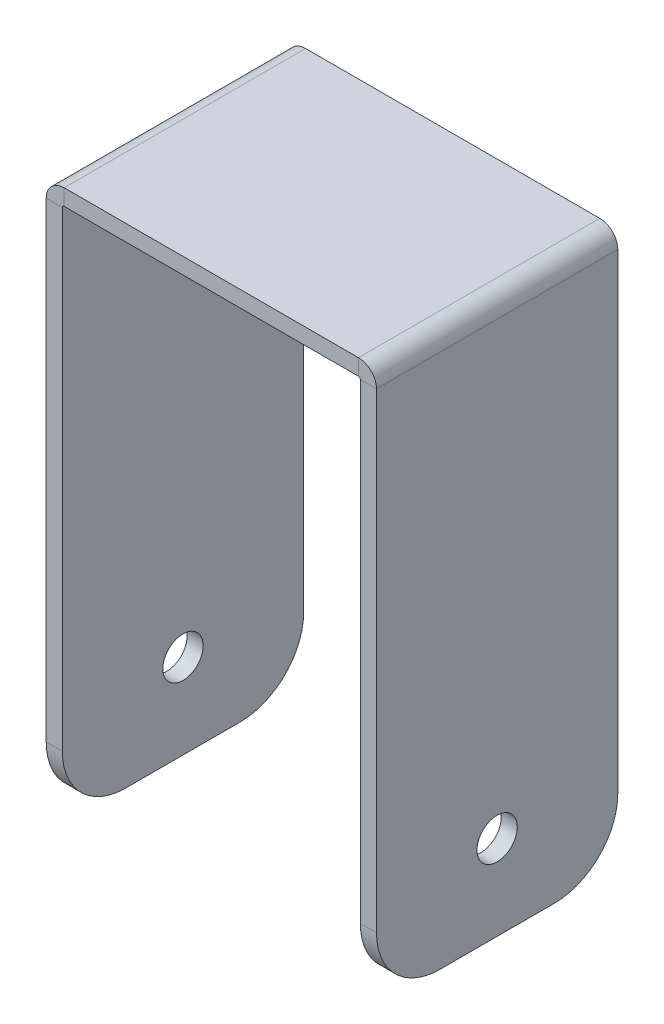
from build123d import *

# Parameters (mm, degrees)
SKETCH3_W                    = 130
SKETCH3_H                    = 95
BASE_FLANGE1_DEPTH           = 6.35
EDGE_FLANGE1_STRIP_W         = 26.8732
EDGE_FLANGE1_STRIP_H         = 6.35
EDGE_FLANGE1_STRIP_CUT_DEPTH = 95
EDGE_FLANGE1_DEPTH           = 95
EDGE_FLANGE1_PROFILE_W       = 95
EDGE_FLANGE1_PROFILE_H       = 210.4009
EDGE_FLANGE1_PROFILE_R       = 7.9375
EDGE_FLANGE1_FLAT_DEPTH      = 6.35
FILLET1_R                    = 25


# Sheet-metal steps are written as plain solids
with BuildPart() as part:
    # Sketch3 → Base-Flange1 (new body)
    with BuildSketch(Plane(origin=(0, 0, 0), x_dir=(1, 0, 0), z_dir=(0, 1, 0))):
        Rectangle(SKETCH3_W, SKETCH3_H)
    extrude(amount=-BASE_FLANGE1_DEPTH)

    # Edge-Flange1 strip (across the edge) → Edge-Flange1 strip cut (cut)
    with BuildSketch(Plane(origin=(65, -6.35, -47.5), x_dir=(-1, 0, 0), z_dir=(0, 0, 1))):
        with Locations((-6.35, -3.175)):
            Rectangle(EDGE_FLANGE1_STRIP_W, EDGE_FLANGE1_STRIP_H)
    edge_flange1_strip_cut = extrude(amount=EDGE_FLANGE1_STRIP_CUT_DEPTH, mode=Mode.SUBTRACT)

    # Edge-Flange1 bend section (across the edge) → Edge-Flange1 (add)
    with BuildSketch(Plane(origin=(65, -6.35, -47.5), x_dir=(-1, 0, 0), z_dir=(0, 0, 1))):
        with BuildLine():
            Line((0, 0.7366), (6.35, 0.7366))
            ThreePointArc((6.35, 0.7366), (6.565745145, 0.215745145), (7.0866, 0))
            Line((7.0866, 0), (7.0866, -6.35))
            ThreePointArc((7.0866, -6.35), (2.075617084, -4.274382916), (0, 0.7366))
        make_face()
    edge_flange1 = extrude(amount=EDGE_FLANGE1_DEPTH)

    # Edge-Flange1 profile (on flange) → Edge-Flange1 flat (add)
    with BuildSketch(Plane(origin=(65, -6.35, 0), x_dir=(0, 0, -1), z_dir=(-1, 0, 0))):
        with Locations((0, 105.93705)):
            Rectangle(EDGE_FLANGE1_PROFILE_W, EDGE_FLANGE1_PROFILE_H)
        with Locations((0, 177.8)):
            Circle(EDGE_FLANGE1_PROFILE_R, mode=Mode.SUBTRACT)
    edge_flange1_flat = extrude(amount=EDGE_FLANGE1_FLAT_DEPTH)

    # Mirror1: Edge-Flange1 strip cut, Edge-Flange1, Edge-Flange1 flat across plane
    add(edge_flange1_strip_cut.mirror(Plane(origin=(0, 0, 0), x_dir=(0, 0, 1), z_dir=(1, 0, 0))), mode=Mode.SUBTRACT)
    add(edge_flange1.mirror(Plane(origin=(0, 0, 0), x_dir=(0, 0, 1), z_dir=(1, 0, 0))))
    add(edge_flange1_flat.mirror(Plane(origin=(0, 0, 0), x_dir=(0, 0, 1), z_dir=(1, 0, 0))))

    # Fillet1
    fillet1_edges = [part.edges().sort_by_distance(p)[0] for p in [
        (61.825, -217.4875, -47.5),
        (61.825, -217.4875, 47.5),
        (-61.825, -217.4875, 47.5),
        (-61.825, -217.4875, -47.5),
    ]]
    fillet(fillet1_edges, radius=FILLET1_R)


solid = part.part
